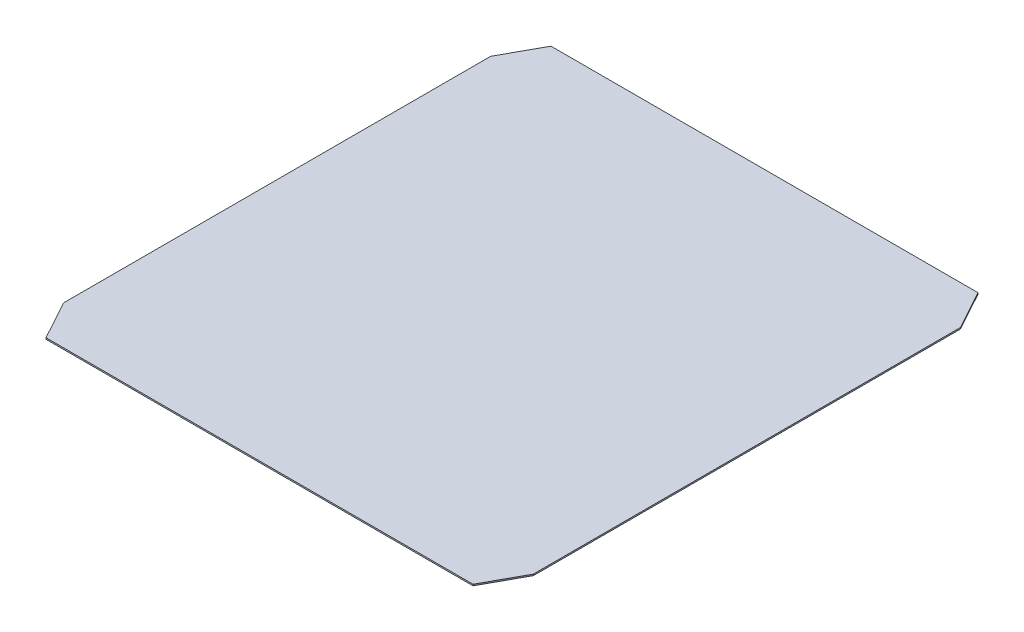
from build123d import *

# Parameters (mm, degrees)
SM_BASE_FLANGE_1_DEPTH = 3


# Sheet-metal steps are written as plain solids
with BuildPart() as part:
    # Sketch 1 → Базовая кромка1 (new body)
    with BuildSketch(Plane(origin=(0, 0, 0), x_dir=(1, 0, 0), z_dir=(0, 1, 0))):
        Polygon((-500.5, 455), (-455, 538), (455, 538), (500.5, 455), (500.5, -455), (455, -538), (-455, -538), (-500.5, -455), align=None)
    extrude(amount=-SM_BASE_FLANGE_1_DEPTH)


solid = part.part
